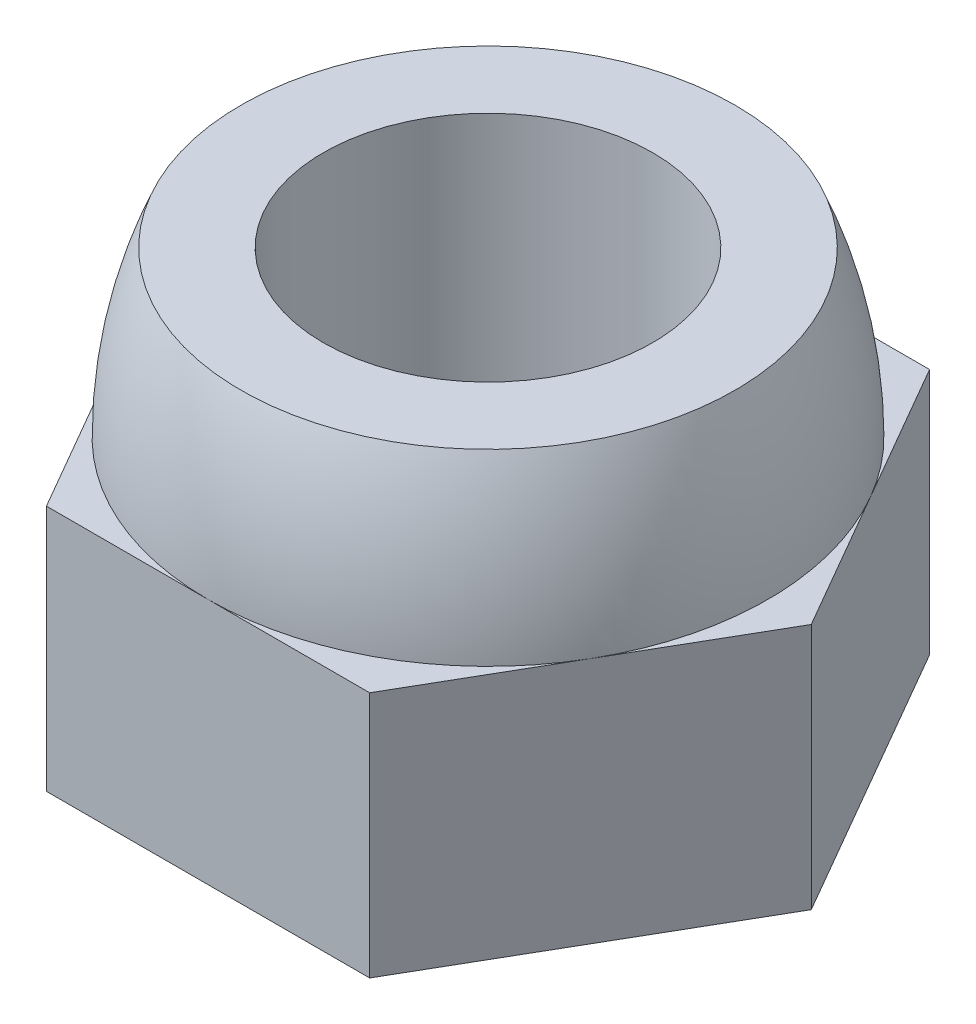
from build123d import *
from build123d.topology import SkipClean

# Parameters (mm, degrees)
SKETCH1_R           = 2
BOSS_EXTRUDE1_DEPTH = 3


with BuildPart() as part:
    # Sketch1 → Boss-Extrude1 (new body)
    with BuildSketch(Plane(origin=(0, 0, 0), x_dir=(1, 0, 0), z_dir=(0, 1, 0))):
        Polygon((-1.962990915, -3.4), (1.962990915, -3.4), (3.92598183, 0), (1.962990915, 3.4), (-1.962990915, 3.4), (-3.92598183, 0), align=None)
        Circle(SKETCH1_R, mode=Mode.SUBTRACT)
    extrude(amount=BOSS_EXTRUDE1_DEPTH)

    # Sketch2 → Revolve1 (revolve)
    with SkipClean():  # the faces are left unmerged after this step: merging them gives an invalid solid
        with BuildSketch(Plane(origin=(0, 0, 0), x_dir=(0, 0, -1), z_dir=(1, 0, 0))):
            with BuildLine():
                Line((-2, 3), (-2, 5))
                Line((-2, 5), (-3, 5))
                ThreePointArc((-3, 5), (-3.299019514, 4.019803903), (-3.4, 3))
                Line((-3.4, 3), (-2, 3))
            make_face()
        revolve(axis=Axis((0, 0, 0), (0, 1, 0)))
    add(part.part.scale(1), mode=Mode.REPLACE)  # the faces are merged on a copy


solid = part.part
